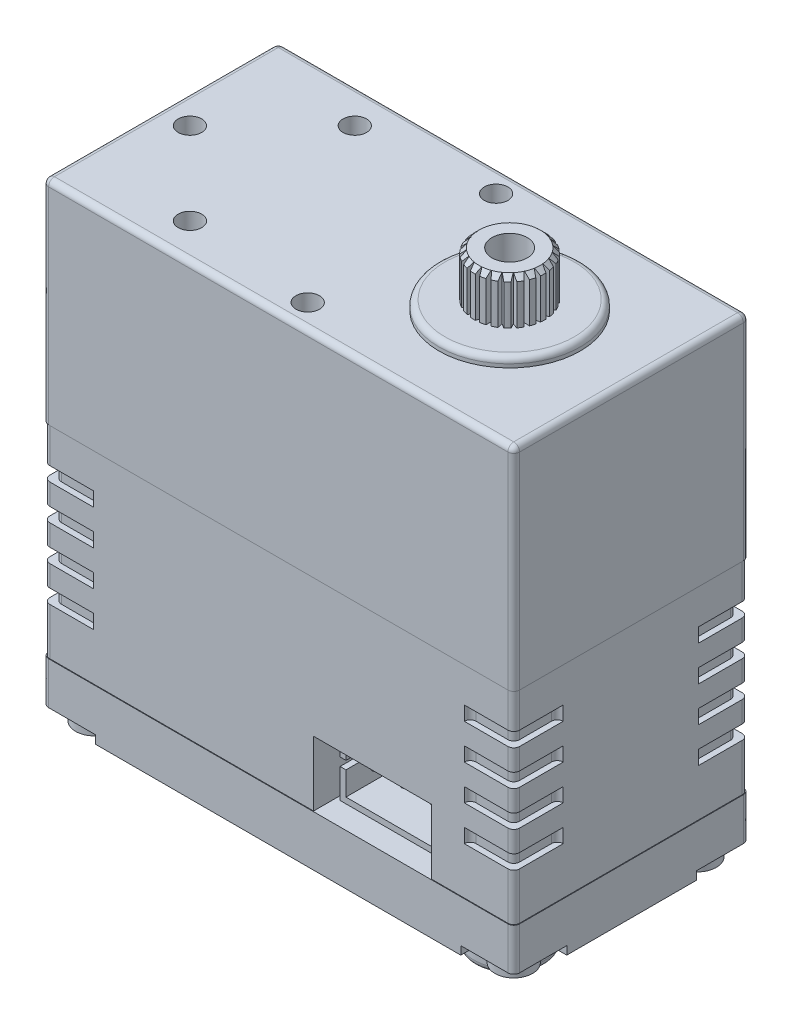
from build123d import *

# Parameters (mm, degrees)
SKETCH_1_W             = 40
SKETCH_1_H             = 20
EXTRUDE_1_DEPTH        = 40
SKETCH_2_W             = 40
SKETCH_2_H             = 17.2
CUT_EXTRUDE_1_DEPTH    = 0.05
SKETCH_3_W             = 19.95
SKETCH_3_H             = 17.2
CUT_EXTRUDE_2_DEPTH    = 0.05
SKETCH_4_W             = 39.95
SKETCH_4_H             = 17.2
CUT_EXTRUDE_3_DEPTH    = 0.05
SKETCH_5_W             = 19.95
SKETCH_5_H             = 17.2
CUT_EXTRUDE_4_DEPTH    = 0.05
SKETCH_6_W             = 4.2
SKETCH_6_H             = 1.2
CUT_EXTRUDE_5_DEPTH    = 0.5
SKETCH_7_W             = 4.2
SKETCH_7_H             = 1.2
CUT_EXTRUDE_6_DEPTH    = 0.5
SKETCH_8_W             = 4.2
SKETCH_8_H             = 1.2
CUT_EXTRUDE_7_DEPTH    = 0.5
SKETCH_9_W             = 4.2
SKETCH_9_H             = 1.2
CUT_EXTRUDE_8_DEPTH    = 0.5
CUT_EXTRUDE_9_DEPTH    = 1.2
FILLET_1_R             = 0.5
CHAMFER_1_SIZE         = 0.5
SKETCH_12_R            = 1.6
EXTRUDE_2_DEPTH        = 1.2
CUT_EXTRUDE_10_DEPTH   = 0.5
SKETCH_14_R            = 6
EXTRUDE_3_DEPTH        = 0.8
SKETCH_15_R            = 3
EXTRUDE_4_DEPTH        = 3.8
CUT_EXTRUDE_START      = -3.8
SKETCH_16_R            = 1.5
CUT_EXTRUDE_11_DEPTH   = 3.8
SKETCH_17_R            = 1
CUT_EXTRUDE_12_DEPTH   = 4.5
FILLET_2_R             = 0.5
CHAMFER_2_SIZE         = 0.4
FILLET_2_OF_MIRROR_2_R = 0.5
EXTRUDE_START          = 6
SKETCH_18_R            = 3
EXTRUDE_5_DEPTH        = 6
FILLET_4_R             = 0.5
SKETCH_19_W            = 10
SKETCH_19_H            = 5.5
CUT_EXTRUDE_13_DEPTH   = 6
EXTRUDE_6_DEPTH        = 4.5
SKETCH_21_R            = 0.25
EXTRUDE_7_DEPTH        = 3.5


with BuildPart() as part:
    # 草图1 → 凸台-拉伸1 (new body)
    with BuildSketch(Plane(origin=(0, 0, 0), x_dir=(1, 0, 0), z_dir=(0, 1, 0))):
        Rectangle(SKETCH_1_W, SKETCH_1_H)
    extrude(amount=EXTRUDE_1_DEPTH)

    # 草图2 → 切除-拉伸1 (cut)
    with BuildSketch(Plane.XY.offset(10)):
        with Locations((0, 13.4)):
            Rectangle(SKETCH_2_W, SKETCH_2_H)
    extrude(amount=-CUT_EXTRUDE_1_DEPTH, mode=Mode.SUBTRACT)

    # 草图3 → 切除-拉伸2 (cut)
    with BuildSketch(Plane(origin=(20, 0, 0), x_dir=(0, 0, -1), z_dir=(1, 0, 0))):
        with Locations((0.025, 13.4)):
            Rectangle(SKETCH_3_W, SKETCH_3_H)
    extrude(amount=-CUT_EXTRUDE_2_DEPTH, mode=Mode.SUBTRACT)

    # 草图4 → 切除-拉伸3 (cut)
    with BuildSketch(Plane(origin=(0, 0, -10), x_dir=(-1, 0, 0), z_dir=(0, 0, -1))):
        with Locations((0.025, 13.4)):
            Rectangle(SKETCH_4_W, SKETCH_4_H)
    extrude(amount=-CUT_EXTRUDE_3_DEPTH, mode=Mode.SUBTRACT)

    # 草图5 → 切除-拉伸4 (cut)
    with BuildSketch(Plane.ZY.offset(20)):
        with Locations((0.025, 13.4)):
            Rectangle(SKETCH_5_W, SKETCH_5_H)
    extrude(amount=-CUT_EXTRUDE_4_DEPTH, mode=Mode.SUBTRACT)

    # 草图6 → 切除-拉伸5 (cut)
    with BuildSketch(Plane(origin=(0, 0, -9.95), x_dir=(-1, 0, 0), z_dir=(0, 0, -1))):
        with Locations((17.85, 18.4)):
            Rectangle(SKETCH_6_W, SKETCH_6_H)
        with Locations((17.85, 15.4)):
            Rectangle(SKETCH_6_W, SKETCH_6_H)
        with Locations((17.85, 12.4)):
            Rectangle(SKETCH_6_W, SKETCH_6_H)
        with Locations((17.85, 9.4)):
            Rectangle(SKETCH_6_W, SKETCH_6_H)
        with Locations((-17.85, 9.4)):
            Rectangle(SKETCH_6_W, SKETCH_6_H)
        with Locations((-17.85, 12.4)):
            Rectangle(SKETCH_6_W, SKETCH_6_H)
        with Locations((-17.85, 15.4)):
            Rectangle(SKETCH_6_W, SKETCH_6_H)
        with Locations((-17.85, 18.4)):
            Rectangle(SKETCH_6_W, SKETCH_6_H)
    extrude(amount=-CUT_EXTRUDE_5_DEPTH, mode=Mode.SUBTRACT)

    # 草图7 → 切除-拉伸6 (cut)
    with BuildSketch(Plane.ZY.offset(19.95)):
        with Locations((-7.85, 15.4)):
            Rectangle(SKETCH_7_W, SKETCH_7_H)
        with Locations((-7.85, 18.4)):
            Rectangle(SKETCH_7_W, SKETCH_7_H)
        with Locations((-7.85, 12.4)):
            Rectangle(SKETCH_7_W, SKETCH_7_H)
        with Locations((-7.85, 9.4)):
            Rectangle(SKETCH_7_W, SKETCH_7_H)
        with Locations((7.85, 9.4)):
            Rectangle(SKETCH_7_W, SKETCH_7_H)
        with Locations((7.85, 12.4)):
            Rectangle(SKETCH_7_W, SKETCH_7_H)
        with Locations((7.85, 15.4)):
            Rectangle(SKETCH_7_W, SKETCH_7_H)
        with Locations((7.85, 18.4)):
            Rectangle(SKETCH_7_W, SKETCH_7_H)
    extrude(amount=-CUT_EXTRUDE_6_DEPTH, mode=Mode.SUBTRACT)

    # 草图8 → 切除-拉伸7 (cut)
    with BuildSketch(Plane.XY.offset(9.95)):
        with Locations((-17.85, 18.4)):
            Rectangle(SKETCH_8_W, SKETCH_8_H)
        with Locations((-17.85, 15.4)):
            Rectangle(SKETCH_8_W, SKETCH_8_H)
        with Locations((-17.85, 12.4)):
            Rectangle(SKETCH_8_W, SKETCH_8_H)
        with Locations((-17.85, 9.4)):
            Rectangle(SKETCH_8_W, SKETCH_8_H)
        with Locations((17.85, 9.4)):
            Rectangle(SKETCH_8_W, SKETCH_8_H)
        with Locations((17.85, 12.4)):
            Rectangle(SKETCH_8_W, SKETCH_8_H)
        with Locations((17.85, 15.4)):
            Rectangle(SKETCH_8_W, SKETCH_8_H)
        with Locations((17.85, 18.4)):
            Rectangle(SKETCH_8_W, SKETCH_8_H)
    extrude(amount=-CUT_EXTRUDE_7_DEPTH, mode=Mode.SUBTRACT)

    # 草图9 → 切除-拉伸8 (cut)
    with BuildSketch(Plane(origin=(19.95, 0, 0), x_dir=(0, 0, -1), z_dir=(1, 0, 0))):
        with Locations((-7.85, 18.4)):
            Rectangle(SKETCH_9_W, SKETCH_9_H)
        with Locations((-7.85, 15.4)):
            Rectangle(SKETCH_9_W, SKETCH_9_H)
        with Locations((-7.85, 12.4)):
            Rectangle(SKETCH_9_W, SKETCH_9_H)
        with Locations((-7.85, 9.4)):
            Rectangle(SKETCH_9_W, SKETCH_9_H)
        with Locations((7.85, 9.4)):
            Rectangle(SKETCH_9_W, SKETCH_9_H)
        with Locations((7.85, 12.4)):
            Rectangle(SKETCH_9_W, SKETCH_9_H)
        with Locations((7.85, 15.4)):
            Rectangle(SKETCH_9_W, SKETCH_9_H)
        with Locations((7.85, 18.4)):
            Rectangle(SKETCH_9_W, SKETCH_9_H)
    extrude(amount=-CUT_EXTRUDE_8_DEPTH, mode=Mode.SUBTRACT)

    # 草图10 → 切除-拉伸9 (cut)
    with BuildSketch(Plane.XZ):
        with BuildLine():
            Line((-20, -5.5), (-19, -5.5))
            ThreePointArc((-19, -5.5), (-16.525126266, -6.525126266), (-15.5, -9))
            Line((-15.5, -9), (-15.5, -10))
            Line((-15.5, -10), (-20, -10))
            Line((-20, -10), (-20, -5.5))
        make_face()
        with BuildLine():
            Line((-20, 10), (-15.5, 10))
            Line((-15.5, 10), (-15.5, 9))
            ThreePointArc((-15.5, 9), (-16.525126266, 6.525126266), (-19, 5.5))
            Line((-19, 5.5), (-20, 5.5))
            Line((-20, 5.5), (-20, 10))
        make_face()
        with BuildLine():
            Line((20, -10), (20, -5.5))
            Line((20, -5.5), (19, -5.5))
            ThreePointArc((19, -5.5), (16.525126266, -6.525126266), (15.5, -9))
            Line((15.5, -9), (15.5, -10))
            Line((15.5, -10), (20, -10))
        make_face()
        with BuildLine():
            Line((20, 5.5), (19, 5.5))
            ThreePointArc((19, 5.5), (16.525126266, 6.525126266), (15.5, 9))
            Line((15.5, 9), (15.5, 10))
            Line((15.5, 10), (20, 10))
            Line((20, 10), (20, 5.5))
        make_face()
    extrude(amount=-CUT_EXTRUDE_9_DEPTH, mode=Mode.SUBTRACT)

    # 圆角1
    fillet_1_edges = [part.edges().sort_by_distance(p)[0] for p in [
        (20, 3, 10),
        (19.95, 6.8, 9.95),
        (19.45, 9.4, 9.45),
        (19.95, 10.9, 9.95),
        (19.45, 12.4, 9.45),
        (19.95, 13.9, 9.95),
        (19.45, 15.4, 9.45),
        (19.95, 16.9, 9.95),
        (19.45, 18.4, 9.45),
        (20, 31, 10),
        (19.95, 20.5, 9.95),
        (-20, 3, 10),
        (-19.95, 6.8, 9.95),
        (-19.45, 9.4, 9.45),
        (-19.95, 10.9, 9.95),
        (-19.45, 12.4, 9.45),
        (-19.95, 13.9, 9.95),
        (-19.45, 15.4, 9.45),
        (-19.95, 16.9, 9.95),
        (-19.45, 18.4, 9.45),
        (-20, 31, 10),
        (-19.95, 20.5, 9.95),
        (-20, 3, -10),
        (-19.95, 6.8, -9.95),
        (-19.45, 9.4, -9.45),
        (-19.95, 10.9, -9.95),
        (-19.45, 12.4, -9.45),
        (-19.95, 13.9, -9.95),
        (-19.45, 15.4, -9.45),
        (-19.95, 16.9, -9.95),
        (-19.45, 18.4, -9.45),
        (-20, 31, -10),
        (-19.95, 20.5, -9.95),
        (-20, 40, 0),
        (0, 40, 10),
        (20, 40, 0),
        (20, 3, -10),
        (19.95, 6.8, -9.95),
        (19.45, 9.4, -9.45),
        (19.95, 10.9, -9.95),
        (19.45, 12.4, -9.45),
        (19.95, 13.9, -9.95),
        (19.95, 16.9, -9.95),
        (19.45, 15.4, -9.45),
        (19.45, 18.4, -9.45),
        (20, 31, -10),
        (19.95, 20.5, -9.95),
        (0, 40, -10),
        (19.45, 9.4, 5.75),
        (19.45, 12.4, 5.75),
        (19.45, 15.4, 5.75),
        (19.45, 18.4, 5.75),
        (15.75, 9.4, 9.45),
        (15.75, 12.4, 9.45),
        (15.75, 15.4, 9.45),
        (15.75, 18.4, 9.45),
        (19.45, 18.4, -5.75),
        (19.45, 15.4, -5.75),
        (19.45, 12.4, -5.75),
        (19.45, 9.4, -5.75),
        (15.75, 9.4, -9.45),
        (15.75, 12.4, -9.45),
        (15.75, 15.4, -9.45),
        (15.75, 18.4, -9.45),
        (-15.75, 9.4, -9.45),
        (-15.75, 12.4, -9.45),
        (-15.75, 15.4, -9.45),
        (-15.75, 18.4, -9.45),
        (-19.45, 9.4, -5.75),
        (-19.45, 12.4, -5.75),
        (-19.45, 15.4, -5.75),
        (-19.45, 18.4, -5.75),
        (-15.75, 9.4, 9.45),
        (-15.75, 12.4, 9.45),
        (-15.75, 15.4, 9.45),
        (-15.75, 18.4, 9.45),
        (-19.45, 9.4, 5.75),
        (-19.45, 12.4, 5.75),
        (-19.45, 15.4, 5.75),
        (-19.45, 18.4, 5.75),
    ]]
    fillet(fillet_1_edges, radius=FILLET_1_R - 0.0001)  # a hair under: the kernel refuses the full size

    # 倒角1
    chamfer_1_edges = [part.edges().sort_by_distance(p)[0] for p in [
        (-20, 0, 0),
        (0, 0, -10),
        (20, 0, 0),
        (0, 0, 10),
        (15.5, 0, 9.5),
        (16.525126266, 0, 6.525126266),
        (19.5, 0, 5.5),
        (19.5, 0, -5.5),
        (16.525126266, 0, -6.525126266),
        (15.5, 0, -9.5),
        (-15.5, 0, -9.5),
        (-16.525126266, 0, -6.525126266),
        (-19.5, 0, -5.5),
        (-19.5, 0, 5.5),
        (-16.525126266, 0, 6.525126266),
        (-15.5, 0, 9.5),
    ]]
    chamfer(chamfer_1_edges, length=CHAMFER_1_SIZE)

    # 草图12 → 凸台-拉伸2 (add)
    with BuildSketch(Plane.XZ.offset(-1.2)):
        with Locations(Location((-17.8, 7.8, 0), (0, 0, 270))):
            Circle(SKETCH_12_R)
        with Locations(Location((-17.8, -7.8, 0), (0, 0, 90))):
            Circle(SKETCH_12_R)
        with Locations(Location((17.8, -7.8, 0), (0, 0, 270))):
            Circle(SKETCH_12_R)
        with Locations(Location((17.8, 7.8, 0), (0, 0, 90))):
            Circle(SKETCH_12_R)
    extrude(amount=EXTRUDE_2_DEPTH)

    # 草图13 → 切除-拉伸10 (cut)
    with BuildSketch(Plane.XZ):
        Polygon((-18.3, 8.666025404), (-17.3, 8.666025404), (-16.8, 7.8), (-17.3, 6.933974596), (-18.3, 6.933974596), (-18.8, 7.8), align=None)
        Polygon((-18.3, -6.933974596), (-18.8, -7.8), (-18.3, -8.666025404), (-17.3, -8.666025404), (-16.8, -7.8), (-17.3, -6.933974596), align=None)
        Polygon((17.3, -6.933974596), (18.3, -6.933974596), (18.8, -7.8), (18.3, -8.666025404), (17.3, -8.666025404), (16.8, -7.8), align=None)
        Polygon((18.3, 6.933974596), (18.8, 7.8), (18.3, 8.666025404), (17.3, 8.666025404), (16.8, 7.8), (17.3, 6.933974596), align=None)
    extrude(amount=-CUT_EXTRUDE_10_DEPTH, mode=Mode.SUBTRACT)

    # 草图14 → 凸台-拉伸3 (add)
    with BuildSketch(Plane(origin=(0, 40, 0), x_dir=(1, 0, 0), z_dir=(0, 1, 0))):
        with Locations(Location((9.65, 0, 0), (0, 0, 270))):
            Circle(SKETCH_14_R)
    extrude_3 = extrude(amount=EXTRUDE_3_DEPTH)

    # 草图15 → 凸台-拉伸4 (add)
    with BuildSketch(Plane(origin=(0, 40.8, 0), x_dir=(1, 0, 0), z_dir=(0, 1, 0))):
        with Locations(Location((9.65, 0, 0), (0, 0, 90))):
            Circle(SKETCH_15_R)
    extrude(amount=EXTRUDE_4_DEPTH)

    # 草图16 → 切除-拉伸11 (cut)
    with BuildSketch(Plane(origin=(0, 44.6, 0), x_dir=(1, 0, 0), z_dir=(0, 1, 0)).offset(CUT_EXTRUDE_START)):
        with Locations(Location((9.65, 0, 0), (0, 0, 270))):
            Circle(SKETCH_16_R)
        with BuildLine():
            Line((9.220370347, 2.969077022), (9.428527521, 2.562292136))
            Line((9.428527521, 2.562292136), (9.569559776, 2.998921368))
            ThreePointArc((9.569559776, 2.998921368), (9.394528884, 2.989102626), (9.220370347, 2.969077022))
        make_face()
        with BuildLine():
            Line((10.099244017, 2.532305444), (10.348478674, 2.917555062))
            ThreePointArc((10.348478674, 2.917555062), (10.176870538, 2.953372214), (10.003463302, 2.979104512))
            Line((10.003463302, 2.979104512), (10.099244017, 2.532305444))
        make_face()
        with BuildLine():
            Line((10.739345276, 2.329746321), (11.079797406, 2.637362201))
            ThreePointArc((11.079797406, 2.637362201), (10.923306836, 2.716374367), (10.762468317, 2.786110953))
            Line((10.762468317, 2.786110953), (10.739345276, 2.329746321))
        make_face()
        with BuildLine():
            Line((11.305209454, 1.968418836), (11.713677807, 2.177437464))
            ThreePointArc((11.713677807, 2.177437464), (11.582969378, 2.294260095), (11.445660455, 2.403248537))
            Line((11.445660455, 2.403248537), (11.305209454, 1.968418836))
        make_face()
        with BuildLine():
            Line((11.758273843, 1.472946861), (12.206921976, 1.569123962))
            ThreePointArc((12.206921976, 1.569123962), (12.110903251, 1.71579579), (12.0064813, 1.856608705))
            Line((12.0064813, 1.856608705), (11.758273843, 1.472946861))
        make_face()
        with BuildLine():
            Line((12.067662854, 0.877095991), (12.525916138, 0.853877255))
            ThreePointArc((12.525916138, 0.853877255), (12.471130634, 1.020402836), (12.406711839, 1.183444057))
            Line((12.406711839, 1.183444057), (12.067662854, 0.877095991))
        make_face()
        with BuildLine():
            Line((12.212292136, 0.221472479), (12.648921368, 0.080440224))
            ThreePointArc((12.648921368, 0.080440224), (12.639102626, 0.255471116), (12.619077022, 0.429629653))
            Line((12.619077022, 0.429629653), (12.212292136, 0.221472479))
        make_face()
        with BuildLine():
            Line((12.182305444, -0.449244017), (12.567555062, -0.698478674))
            ThreePointArc((12.567555062, -0.698478674), (12.603372214, -0.526870538), (12.629104512, -0.353463302))
            Line((12.629104512, -0.353463302), (12.182305444, -0.449244017))
        make_face()
        with BuildLine():
            Line((11.979746321, -1.089345276), (12.287362201, -1.429797406))
            ThreePointArc((12.287362201, -1.429797406), (12.366374367, -1.273306836), (12.436110953, -1.112468317))
            Line((12.436110953, -1.112468317), (11.979746321, -1.089345276))
        make_face()
        with BuildLine():
            Line((11.618418836, -1.655209454), (11.827437464, -2.063677807))
            ThreePointArc((11.827437464, -2.063677807), (11.944260095, -1.932969378), (12.053248537, -1.795660455))
            Line((12.053248537, -1.795660455), (11.618418836, -1.655209454))
        make_face()
        with BuildLine():
            Line((11.122946861, -2.108273843), (11.219123962, -2.556921976))
            ThreePointArc((11.219123962, -2.556921976), (11.36579579, -2.460903251), (11.506608705, -2.3564813))
            Line((11.506608705, -2.3564813), (11.122946861, -2.108273843))
        make_face()
        with BuildLine():
            Line((10.527095991, -2.417662854), (10.503877255, -2.875916138))
            ThreePointArc((10.503877255, -2.875916138), (10.670402836, -2.821130634), (10.833444057, -2.756711839))
            Line((10.833444057, -2.756711839), (10.527095991, -2.417662854))
        make_face()
        with BuildLine():
            Line((9.871472479, -2.562292136), (9.730440224, -2.998921368))
            ThreePointArc((9.730440224, -2.998921368), (9.905471116, -2.989102626), (10.079629653, -2.969077022))
            Line((10.079629653, -2.969077022), (9.871472479, -2.562292136))
        make_face()
        with BuildLine():
            Line((9.200755983, -2.532305444), (8.951521326, -2.917555062))
            ThreePointArc((8.951521326, -2.917555062), (9.123129462, -2.953372214), (9.296536698, -2.979104512))
            Line((9.296536698, -2.979104512), (9.200755983, -2.532305444))
        make_face()
        with BuildLine():
            Line((8.560654724, -2.329746321), (8.220202594, -2.637362201))
            ThreePointArc((8.220202594, -2.637362201), (8.376693164, -2.716374367), (8.537531683, -2.786110953))
            Line((8.537531683, -2.786110953), (8.560654724, -2.329746321))
        make_face()
        with BuildLine():
            Line((7.994790546, -1.968418836), (7.586322193, -2.177437464))
            ThreePointArc((7.586322193, -2.177437464), (7.717030622, -2.294260095), (7.854339545, -2.403248537))
            Line((7.854339545, -2.403248537), (7.994790546, -1.968418836))
        make_face()
        with BuildLine():
            Line((7.541726157, -1.472946861), (7.093078024, -1.569123962))
            ThreePointArc((7.093078024, -1.569123962), (7.189096749, -1.71579579), (7.2935187, -1.856608705))
            Line((7.2935187, -1.856608705), (7.541726157, -1.472946861))
        make_face()
        with BuildLine():
            Line((7.232337146, -0.877095991), (6.774083862, -0.853877255))
            ThreePointArc((6.774083862, -0.853877255), (6.828869366, -1.020402836), (6.893288161, -1.183444057))
            Line((6.893288161, -1.183444057), (7.232337146, -0.877095991))
        make_face()
        with BuildLine():
            Line((7.087707864, -0.221472479), (6.651078632, -0.080440224))
            ThreePointArc((6.651078632, -0.080440224), (6.660897374, -0.255471116), (6.680922978, -0.429629653))
            Line((6.680922978, -0.429629653), (7.087707864, -0.221472479))
        make_face()
        with BuildLine():
            Line((7.117694556, 0.449244017), (6.732444938, 0.698478674))
            ThreePointArc((6.732444938, 0.698478674), (6.696627786, 0.526870538), (6.670895488, 0.353463302))
            Line((6.670895488, 0.353463302), (7.117694556, 0.449244017))
        make_face()
        with BuildLine():
            Line((7.320253679, 1.089345276), (7.012637799, 1.429797406))
            ThreePointArc((7.012637799, 1.429797406), (6.933625633, 1.273306836), (6.863889047, 1.112468317))
            Line((6.863889047, 1.112468317), (7.320253679, 1.089345276))
        make_face()
        with BuildLine():
            Line((7.681581164, 1.655209454), (7.472562536, 2.063677807))
            ThreePointArc((7.472562536, 2.063677807), (7.355739905, 1.932969378), (7.246751463, 1.795660455))
            Line((7.246751463, 1.795660455), (7.681581164, 1.655209454))
        make_face()
        with BuildLine():
            Line((8.177053139, 2.108273843), (8.080876038, 2.556921976))
            ThreePointArc((8.080876038, 2.556921976), (7.93420421, 2.460903251), (7.793391295, 2.3564813))
            Line((7.793391295, 2.3564813), (8.177053139, 2.108273843))
        make_face()
        with BuildLine():
            Line((8.772904009, 2.417662854), (8.796122745, 2.875916138))
            ThreePointArc((8.796122745, 2.875916138), (8.629597164, 2.821130634), (8.466555943, 2.756711839))
            Line((8.466555943, 2.756711839), (8.772904009, 2.417662854))
        make_face()
    extrude(amount=CUT_EXTRUDE_11_DEPTH, mode=Mode.SUBTRACT)

    # 草图17 → 切除-拉伸12 (cut)
    with BuildSketch(Plane(origin=(0, 40, 0), x_dir=(1, 0, 0), z_dir=(0, 1, 0))):
        with Locations(Location((-17.5, 0, 0), (0, 0, 270))):
            Circle(SKETCH_17_R)
        with Locations(Location((0.5, 8, 0), (0, 0, 270))):
            Circle(SKETCH_17_R)
        with Locations(Location((-10.5, 7, 0), (0, 0, 270))):
            Circle(SKETCH_17_R)
        with Locations(Location((0.5, -8, 0), (0, 0, 90))):
            Circle(SKETCH_17_R)
        with Locations(Location((-10.5, -7, 0), (0, 0, 90))):
            Circle(SKETCH_17_R)
    cut_extrude_12 = extrude(amount=-CUT_EXTRUDE_12_DEPTH, mode=Mode.SUBTRACT)

    # 镜向1: 切除-拉伸12 across plane
    add(cut_extrude_12.mirror(Plane.ZX.offset(20)), mode=Mode.SUBTRACT)

    # 圆角2
    fillet_2_edges = [part.edges().sort_by_distance(p)[0] for p in [
        (9.65, 40.8, -6),
    ]]
    fillet(fillet_2_edges, radius=FILLET_2_R)

    # 倒角2
    chamfer_2_edges = [part.edges().sort_by_distance(p)[0] for p in [
        (10.293441709, 44.6, 2.930184767),
        (11.029904588, 44.6, 2.663806173),
        (11.672329249, 44.6, 2.215893591),
        (12.176935515, 44.6, 1.616971523),
        (12.5093353, 44.6, 0.907855517),
        (12.646876111, 44.6, 0.136870659),
        (12.580184767, 44.6, -0.643441709),
        (12.313806173, 44.6, -1.379904588),
        (11.865893591, 44.6, -2.022329249),
        (11.266971523, 44.6, -2.526935515),
        (10.557855517, 44.6, -2.8593353),
        (9.786870659, 44.6, -2.996876111),
        (9.006558291, 44.6, -2.930184767),
        (8.270095412, 44.6, -2.663806173),
        (7.627670751, 44.6, -2.215893591),
        (7.123064485, 44.6, -1.616971523),
        (6.7906647, 44.6, -0.907855517),
        (6.653123889, 44.6, -0.136870659),
        (6.719815233, 44.6, 0.643441709),
        (6.986193827, 44.6, 1.379904588),
        (7.434106409, 44.6, 2.022329249),
        (8.033028477, 44.6, 2.526935515),
        (8.742144483, 44.6, 2.8593353),
        (9.513129341, 44.6, 2.996876111),
    ]]
    chamfer(chamfer_2_edges, length=CHAMFER_2_SIZE)

    # 镜向2: 凸台-拉伸3 across plane
    add(extrude_3.mirror(Plane.ZX.offset(20)))

    # 圆角2 of 镜向2
    fillet_2_of_mirror_2_edges = [part.edges().sort_by_distance(p)[0] for p in [
        (9.65, -0.8, -6),
    ]]
    fillet(fillet_2_of_mirror_2_edges, radius=FILLET_2_OF_MIRROR_2_R)

    # 草图18 → 凸台-拉伸5 (add)
    with BuildSketch(Plane.XZ.offset(0.8).offset(EXTRUDE_START)):
        with Locations(Location((9.65, 0, 0), (0, 0, 270))):
            Circle(SKETCH_18_R)
    extrude(amount=-EXTRUDE_5_DEPTH)

    # 圆角4
    fillet_4_edges = [part.edges().sort_by_distance(p)[0] for p in [
        (9.65, -6.8, 3),
    ]]
    fillet(fillet_4_edges, radius=FILLET_4_R)

    # 草图19 → 切除-拉伸13 (cut)
    with BuildSketch(Plane.XY.offset(9.95)):
        with Locations((7.95, 7.55)):
            Rectangle(SKETCH_19_W, SKETCH_19_H)
    cut_extrude_13 = extrude(amount=-CUT_EXTRUDE_13_DEPTH, mode=Mode.SUBTRACT)

    # 草图20 → 凸台-拉伸6 (add)
    with BuildSketch(Plane.XY.offset(3.95)):
        Polygon((3.7, 9.9), (12.2, 9.9), (12.2, 8.4), (11.7, 8.4), (11.7, 8.9), (8.7, 8.9), (8.7, 9.4), (7.2, 9.4), (7.2, 8.9), (4.2, 8.9), (4.2, 8.4), (3.7, 8.4), align=None)
        Polygon((12.2, 7.7), (12.2, 5.2), (3.7, 5.2), (3.7, 7.7), (4.2, 7.7), (4.2, 5.7), (11.7, 5.7), (11.7, 7.7), align=None)
    extrude_6 = extrude(amount=EXTRUDE_6_DEPTH)

    # 草图21 → 凸台-拉伸7 (add)
    with BuildSketch(Plane.XY.offset(3.95)):
        with Locations(Location((7.95, 8, 0), (0, 0, 180))):
            Circle(SKETCH_21_R)
        with Locations(Location((10.45, 8, 0), (0, 0, 180))):
            Circle(SKETCH_21_R)
        with Locations(Location((5.45, 8, 0), (0, 0, 180))):
            Circle(SKETCH_21_R)
    extrude_7 = extrude(amount=EXTRUDE_7_DEPTH)

    # 镜向3: 切除-拉伸13, 凸台-拉伸6, 凸台-拉伸7 across plane
    add(cut_extrude_13.mirror(Plane.XY), mode=Mode.SUBTRACT)
    add(extrude_6.mirror(Plane.XY))
    add(extrude_7.mirror(Plane.XY))


solid = part.part
